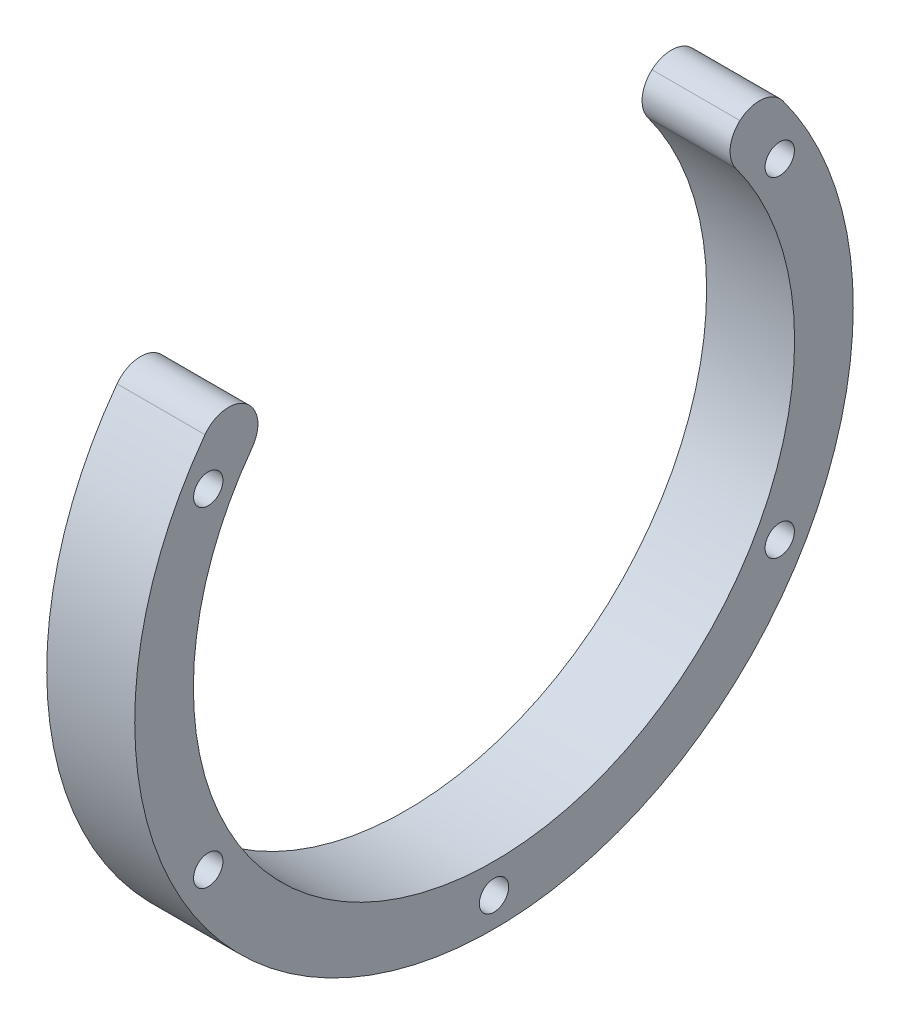
from build123d import *

# Parameters (mm, degrees)
SKETCH1_R           = 49
SKETCH1_R_2         = 41
BOSS_EXTRUDE1_DEPTH = 12
CIRPATTERN1_COUNT   = 6
CUT_EXTRUDE1_START  = -12
CUT_EXTRUDE1_DEPTH  = 12
FILLET1_R           = 4


with BuildPart() as part:
    # Sketch1 → Boss-Extrude1 (new body)
    with BuildSketch(Plane(origin=(0, 0, 0), x_dir=(0, 0, -1), z_dir=(1, 0, 0))):
        Circle(SKETCH1_R)
        Circle(SKETCH1_R_2, mode=Mode.SUBTRACT)
    extrude(amount=BOSS_EXTRUDE1_DEPTH)

    # Sketch3 → Ø4.0mm Dowel Hole1 (revolve, cut)
    with BuildSketch(Plane(origin=(12, 45, 0), x_dir=(0, 0, -1), z_dir=(0, 1, 0))):
        Polygon((0, 0), (0, 51.201721238), (2, 50), (2, 0), align=None)
    f_4_0mm_dowel_hole1 = revolve(axis=Axis((18.35, 45, 0), (-1, 0, 0)), mode=Mode.SUBTRACT)

    # CirPattern1: Ø4.0mm Dowel Hole1 ×6 about axis
    cirpattern1_axis = Axis((0, 0, 0), (1, 0, 0))
    for i in range(1, CIRPATTERN1_COUNT):
        add(f_4_0mm_dowel_hole1.rotate(cirpattern1_axis, i * 360 / CIRPATTERN1_COUNT), mode=Mode.SUBTRACT)

    # Sketch4 → Cut-Extrude1 (cut)
    with BuildSketch(Plane(origin=(12, 0, 0), x_dir=(0, 0, -1), z_dir=(1, 0, 0)).offset(CUT_EXTRUDE1_START)):
        with BuildLine():
            Line((-36.670833097, 32.5), (0, 0))
            Line((0, 0), (36.670833097, 32.5))
            ThreePointArc((36.670833097, 32.5), (0, 49), (-36.670833097, 32.5))
        make_face()
    extrude(amount=CUT_EXTRUDE1_DEPTH, mode=Mode.SUBTRACT)

    # Fillet1
    fillet1_edges = [part.edges().sort_by_distance(p)[0] for p in [
        (6, 32.5, -36.670833097),
        (6, 27.193877551, -30.683758305),
        (6, 27.193877551, 30.683758305),
        (6, 32.5, 36.670833097),
    ]]
    fillet(fillet1_edges, radius=FILLET1_R - 0.0001)  # a hair under: the kernel refuses the full size


solid = part.part
